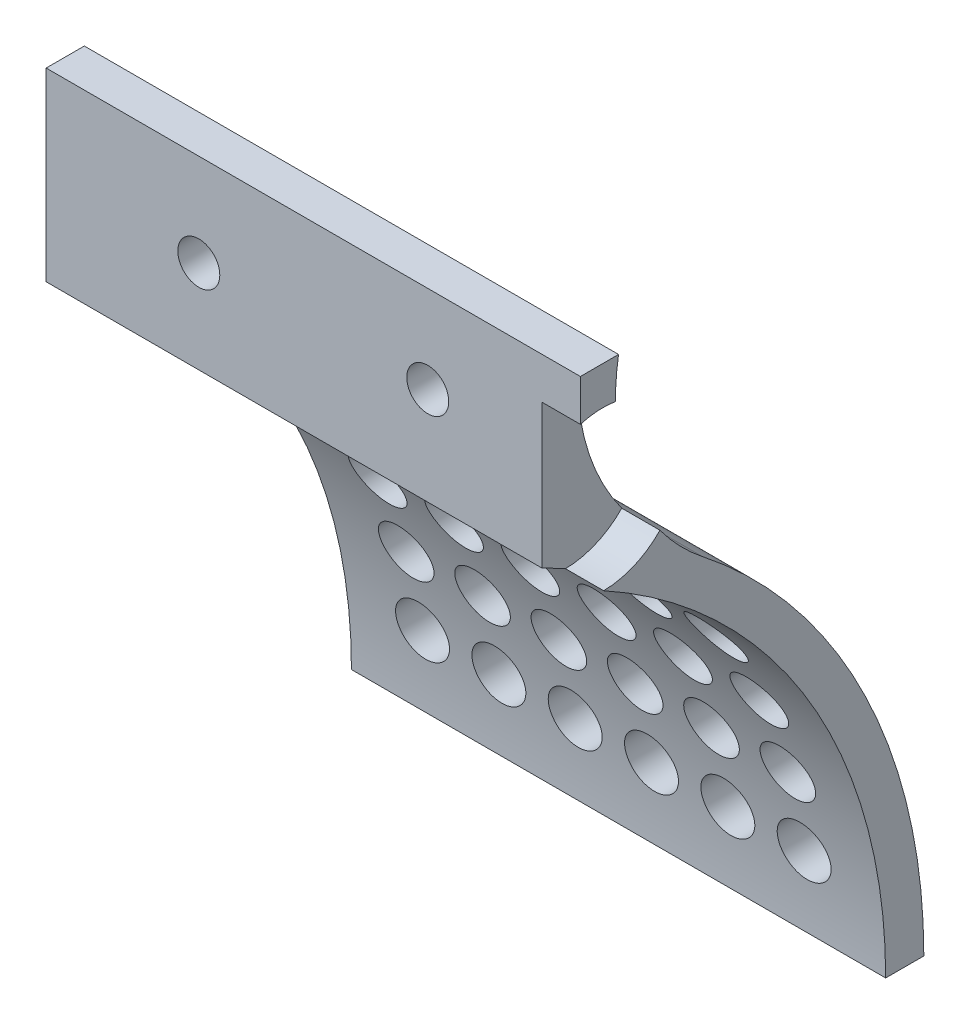
from build123d import *

# Parameters (mm, degrees)
SALIENTE_EXTRUIR1_DEPTH = 70
CROQUIS3_R              = 3.5
CORTAR_EXTRUIR3_DEPTH   = 65
CROQUIS2_R              = 2.750000002
CROQUIS2_R_2            = 2.75
CORTAR_EXTRUIR4_DEPTH   = 65
CROQUIS4_R              = 10.413481513
CORTAR_EXTRUIR5_DEPTH   = 5


with BuildPart() as part:
    # Croquis1 → Saliente-Extruir1 (new body)
    with BuildSketch(Plane(origin=(0, 0, 0), x_dir=(0, 0, -1), z_dir=(1, 0, 0))):
        with BuildLine():
            Line((-25.193840863, 53.195024044), (-20.193840863, 53.195024044))
            ThreePointArc((-20.193840863, 53.195024044), (-18.573108699, 37.469004774), (-9.183016609, 24.750489713))
            ThreePointArc((-9.183016609, 24.750489713), (12.176943033, -1.828536951), (19.806159137, -35.062369049))
            Line((19.806159137, -35.062369049), (14.806159137, -35.062369049))
            ThreePointArc((14.806159137, -35.062369049), (3.983638383, 2.673555479), (-25.193840863, 28.937630951))
            Line((-25.193840863, 28.937630951), (-25.193840863, 53.195024044))
        make_face()
    extrude(amount=SALIENTE_EXTRUIR1_DEPTH)

    # Croquis3 → Cortar-Extruir3 (cut)
    with BuildSketch(Plane.XY.offset(-19.806159137)):
        with Locations((60, 14.750489713)):
            Circle(CROQUIS3_R)
        with Locations((50, 14.750489713)):
            Circle(CROQUIS3_R)
        with Locations((40, 14.750489713)):
            Circle(CROQUIS3_R)
        with Locations((30, 14.750489713)):
            Circle(CROQUIS3_R)
        with Locations((20, 14.750489713)):
            Circle(CROQUIS3_R)
        with Locations((10, 14.750489713)):
            Circle(CROQUIS3_R)
        with Locations((50, 4.750489713)):
            Circle(CROQUIS3_R)
        with Locations((40, 4.750489713)):
            Circle(CROQUIS3_R)
        with Locations((30, 4.750489713)):
            Circle(CROQUIS3_R)
        with Locations((20, 4.750489713)):
            Circle(CROQUIS3_R)
        with Locations((10, 4.750489713)):
            Circle(CROQUIS3_R)
        with Locations((50, -5.249510287)):
            Circle(CROQUIS3_R)
        with Locations((40, -5.249510287)):
            Circle(CROQUIS3_R)
        with Locations((30, -5.249510287)):
            Circle(CROQUIS3_R)
        with Locations((20, -5.249510287)):
            Circle(CROQUIS3_R)
        with Locations((10, -5.249510287)):
            Circle(CROQUIS3_R)
        with Locations((60, 4.750489713)):
            Circle(CROQUIS3_R)
        with Locations((60, -5.249510287)):
            Circle(CROQUIS3_R)
        with Locations((20, -15.249510287)):
            Circle(CROQUIS3_R)
        with Locations((30, -15.249510287)):
            Circle(CROQUIS3_R)
        with Locations((40, -15.249510287)):
            Circle(CROQUIS3_R)
        with Locations((50, -15.249510287)):
            Circle(CROQUIS3_R)
        with Locations((60, -15.249510287)):
            Circle(CROQUIS3_R)
        with Locations((20, -25.249510287)):
            Circle(CROQUIS3_R)
        with Locations((30, -25.249510287)):
            Circle(CROQUIS3_R)
        with Locations((40, -25.249510287)):
            Circle(CROQUIS3_R)
        with Locations((50, -25.249510287)):
            Circle(CROQUIS3_R)
        with Locations((60, -25.249510287)):
            Circle(CROQUIS3_R)
        with Locations((10, -15.249510287)):
            Circle(CROQUIS3_R)
        with Locations((10, -25.249510287)):
            Circle(CROQUIS3_R)
    extrude(amount=CORTAR_EXTRUIR3_DEPTH, mode=Mode.SUBTRACT)

    # Croquis2 → Cortar-Extruir4 (cut)
    with BuildSketch(Plane.XY.offset(25.193840863)):
        with Locations((20, 41.066327497)):
            Circle(CROQUIS2_R)
        with Locations((50, 41.717136777)):
            Circle(CROQUIS2_R_2)
    extrude(amount=-CORTAR_EXTRUIR4_DEPTH, mode=Mode.SUBTRACT)

    # Croquis4 → Cortar-Extruir5 (cut)
    with BuildSketch(Plane(origin=(70, 0, 0), x_dir=(0, 0, -1), z_dir=(1, 0, 0))):
        with Locations((-22.258991111, 37.77140195)):
            Circle(CROQUIS4_R)
    extrude(amount=-CORTAR_EXTRUIR5_DEPTH, mode=Mode.SUBTRACT)


solid = part.part
